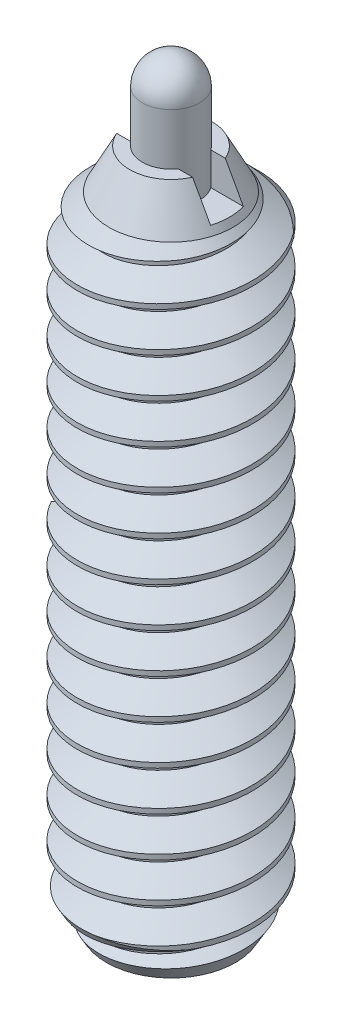
from build123d import *

# Parameters (mm, degrees)
SKETCH24_W          = 1.7526
SKETCH24_H          = 13.4874
SKETCH26_W          = 0.5715
SKETCH26_H          = 12.13866
CUT_SWEEP1_PITCH    = 0.79375
SKETCH37_W          = 0.654652874
SKETCH37_H          = 0.654652874
CUT_EXTRUDE13_DEPTH = 12.7
CUT_EXTRUDE14_DEPTH = 0.5953125
SKETCH21_RX         = 1.17091206
SKETCH21_RY         = 0.893826
EXTRUDE1_DEPTH      = 25.4
SKETCH42_RX         = 1.17091206
SKETCH42_RY         = 0.893826
EXTRUDE2_DEPTH      = 1.237044252
DOME1_HALF_AXIS_A   = 1.17091206
DOME1_HALF_AXIS_B   = 0.893826
DOME1_HEIGHT        = 0.257777874


with BuildPart() as part:
    # Sketch24 → Revolve1 (revolve)
    with BuildSketch(Plane(origin=(0, 0, 0), x_dir=(0, 0, -1), z_dir=(1, 0, 0)), mode=Mode.PRIVATE) as revolve1_sk:
        with Locations((0.8763, 0)):
            Rectangle(SKETCH24_W, SKETCH24_H)
    revolve(revolve1_sk.sketch.rotate(Axis((0, 6.7437, 0), (0, -1, 0)), 180), axis=Axis((0, 6.7437, 0), (0, -1, 0)))

    # Sketch26 → Cut-Revolve10 (revolve, cut)
    with BuildSketch(Plane(origin=(0, 0, 0), x_dir=(0, 0, -1), z_dir=(1, 0, 0))):
        with Locations((0.28575, 0.67437)):
            Rectangle(SKETCH26_W, SKETCH26_H)
    revolve(axis=Axis((0, -5.39496, 0), (0, 1, 0)), mode=Mode.SUBTRACT)

    # Cut-Sweep1: the profile of Sketch39 profile screwed along a right-hand helix of 17.992 turns, 8 arcs to a turn; built about Z, then put on its axis
    cut_sweep1_z = Axis((0, 0, 0), (0, 0, 1))
    cut_sweep1_corners = [(1.7529, 0, -0.694704455), (1.7529, 0, 0.000173205), (1.237044252, 0, -0.29765625), (1.237044252, 0, -0.396875)]
    with BuildLine(mode=Mode.PRIVATE) as cut_sweep1_profile:
        Line(cut_sweep1_corners[0], cut_sweep1_corners[1])
        Line(cut_sweep1_corners[1], cut_sweep1_corners[2])
        Line(cut_sweep1_corners[2], cut_sweep1_corners[3])
        Line(cut_sweep1_corners[3], cut_sweep1_corners[0])
    cut_sweep1_cap = Face(cut_sweep1_profile.wire())
    cut_sweep1_turn_angles = [0, 22.5, 45, 67.5, 90, 112.5, 135, 157.5, 180, 202.5, 225, 247.5, 270, 292.5, 315, 337.5, 360]
    cut_sweep1_turn_weights = [1, 0.9238795325112867, 1, 0.9238795325112867, 1, 0.9238795325112867, 1, 0.9238795325112867, 1, 0.9238795325112867, 1, 0.9238795325112867, 1, 0.9238795325112867, 1, 0.9238795325112867, 1]
    cut_sweep1_turn_rails = [Edge.make_bspline([Vector(p[0], p[1], 0).rotate(cut_sweep1_z, cut_sweep1_turn_angles[k]) / cut_sweep1_turn_weights[k] + Vector(0, 0, p[2] + CUT_SWEEP1_PITCH * cut_sweep1_turn_angles[k] / 360) for k in range(17)], [0, 0, 0, 1, 1, 2, 2, 3, 3, 4, 4, 5, 5, 6, 6, 7, 7, 8, 8, 8], 2, cut_sweep1_turn_weights) for p in cut_sweep1_corners]
    cut_sweep1_turn_sides = [Face.make_surface_from_curves(cut_sweep1_turn_rails[p[0]], cut_sweep1_turn_rails[p[1]]) for p in [(0, 1), (1, 2), (2, 3), (3, 0)]]
    cut_sweep1_last_angles = [6120, 6142.5, 6165, 6187.5, 6210, 6232.5, 6255, 6277.5, 6300, 6322.5, 6345, 6367.5, 6390, 6412.5, 6435, 6456.06, 6477.12]
    cut_sweep1_last_weights = [1, 0.9238795325112867, 1, 0.9238795325112867, 1, 0.9238795325112867, 1, 0.9238795325112867, 1, 0.9238795325112867, 1, 0.9238795325112867, 1, 0.9238795325112867, 1, 0.933204632633859, 1]
    cut_sweep1_last_rails = [Edge.make_bspline([Vector(p[0], p[1], 0).rotate(cut_sweep1_z, cut_sweep1_last_angles[k]) / cut_sweep1_last_weights[k] + Vector(0, 0, p[2] + CUT_SWEEP1_PITCH * cut_sweep1_last_angles[k] / 360) for k in range(17)], [0, 0, 0, 1, 1, 2, 2, 3, 3, 4, 4, 5, 5, 6, 6, 7, 7, 8, 8, 8], 2, cut_sweep1_last_weights) for p in cut_sweep1_corners]
    cut_sweep1_last_sides = [Face.make_surface_from_curves(cut_sweep1_last_rails[p[0]], cut_sweep1_last_rails[p[1]]) for p in [(0, 1), (1, 2), (2, 3), (3, 0)]]
    cut_sweep1 = Plane(origin=(0, 6.7437, 0), x_dir=(0, 0, 1), z_dir=(0, -1, 0)) * Solid(Shell([*[p.moved(Location((0, 0, CUT_SWEEP1_PITCH * i))) for i in range(17) for p in cut_sweep1_turn_sides], *cut_sweep1_last_sides, cut_sweep1_cap, cut_sweep1_cap.rotate(cut_sweep1_z, 6477.12).moved(Location((0, 0, CUT_SWEEP1_PITCH * 6477.12 / 360)))]))
    add(cut_sweep1, mode=Mode.SUBTRACT)

    # Sketch37 → Cut-Extrude13 (cut, symmetric)
    with BuildSketch(Plane(origin=(0, 0, 0), x_dir=(0, 0, -1), z_dir=(1, 0, 0))):
        with Locations((0, 6.416373563)):
            Rectangle(SKETCH37_W, SKETCH37_H)
    extrude(amount=CUT_EXTRUDE13_DEPTH, both=True, mode=Mode.SUBTRACT)

    # Sketch31 → Cut-Revolve13 (revolve, cut)
    with BuildSketch(Plane(origin=(0, 0, 0), x_dir=(0, 0, -1), z_dir=(1, 0, 0))):
        Polygon((1.7526, -6.7437), (1.28905, -6.7437), (1.7526, -5.940807848), align=None)
        Polygon((-1.7526, 5.434394252), (-1.7526, 6.7437), (-0.8255, 6.7437), (-1.237044252, 5.94995), align=None)
    revolve(axis=Axis((0, 6.7437, 0), (0, -1, 0)), mode=Mode.SUBTRACT)

    # Sketch43 → Cut-Extrude14 (cut)
    with BuildSketch(Plane.XZ.offset(6.7437)):
        Polygon((0.396875, -0.229135888), (0.396875, 0.229135888), (0, 0.458271776), (-0.396875, 0.229135888), (-0.396875, -0.229135888), (0, -0.458271776), align=None)
    extrude(amount=-CUT_EXTRUDE14_DEPTH, mode=Mode.SUBTRACT)

    # Cut-Extrude15 cone 1 section (through the dimple's axis) → Cut-Extrude15 (revolve, cut)
    with BuildSketch(Plane(origin=(0, -6.7437, 0), x_dir=(0, 0, -1), z_dir=(1, 0, 0))):
        Polygon((0, 0), (0.458271776, 0), (0, 0.458271776), align=None)
    revolve(axis=Axis((0, -6.7437, 0), (0, 1, 0)), mode=Mode.SUBTRACT)

    # Sketch21 → Extrude1 (cut)
    with BuildSketch(Plane(origin=(0, 0, 0), x_dir=(0, 0, -1), z_dir=(1, 0, 0))):
        with Locations(Location((0, 0), (0, 0, 90))):
            Ellipse(SKETCH21_RX, SKETCH21_RY)
    extrude(amount=-EXTRUDE1_DEPTH, mode=Mode.SUBTRACT)


with BuildPart() as body_2:
    # Sketch27 → Revolve2 (revolve)
    with BuildSketch(Plane(origin=(0, 0, 0), x_dir=(0, 0, -1), z_dir=(1, 0, 0))):
        with BuildLine():
            Line((0.5715, 7.7724), (0.5715, 5.434394252))
            Line((0.5715, 5.434394252), (0, 5.434394252))
            Line((0, 5.434394252), (0, 6.089047126))
            Line((0, 6.089047126), (0, 8.3439))
            ThreePointArc((0, 8.3439), (0.404111525, 8.176511525), (0.5715, 7.7724))
        make_face()
    revolve(axis=Axis((0, 8.3439, 0), (0, -1, 0)))


with BuildPart() as body_3:
    # Sketch42 → Extrude2 (new body)
    with BuildSketch(Plane(origin=(0, 0, 0), x_dir=(0, 0, -1), z_dir=(1, 0, 0))):
        with Locations(Location((0, 0), (0, 0, 90))):
            Ellipse(SKETCH42_RX, SKETCH42_RY)
    extrude(amount=-EXTRUDE2_DEPTH)

    # Dome1: an elliptical dome of height H over an elliptical face of half axes A and B is half an ellipsoid of half axes A, B and H
    dome1_base = Plane((-1.237044252, 0, 0), x_dir=(0, 1, 0), z_dir=(-1, 0, 0))  # on the face, x along the ellipse's major axis
    dome1_ball = dome1_base * scale(Sphere(1, mode=Mode.PRIVATE), by=(DOME1_HALF_AXIS_A, DOME1_HALF_AXIS_B, DOME1_HEIGHT), mode=Mode.PRIVATE)
    add(split(dome1_ball, bisect_by=dome1_base, keep=Keep.TOP, mode=Mode.PRIVATE))


solid = Compound([part.part, body_2.part, body_3.part])
